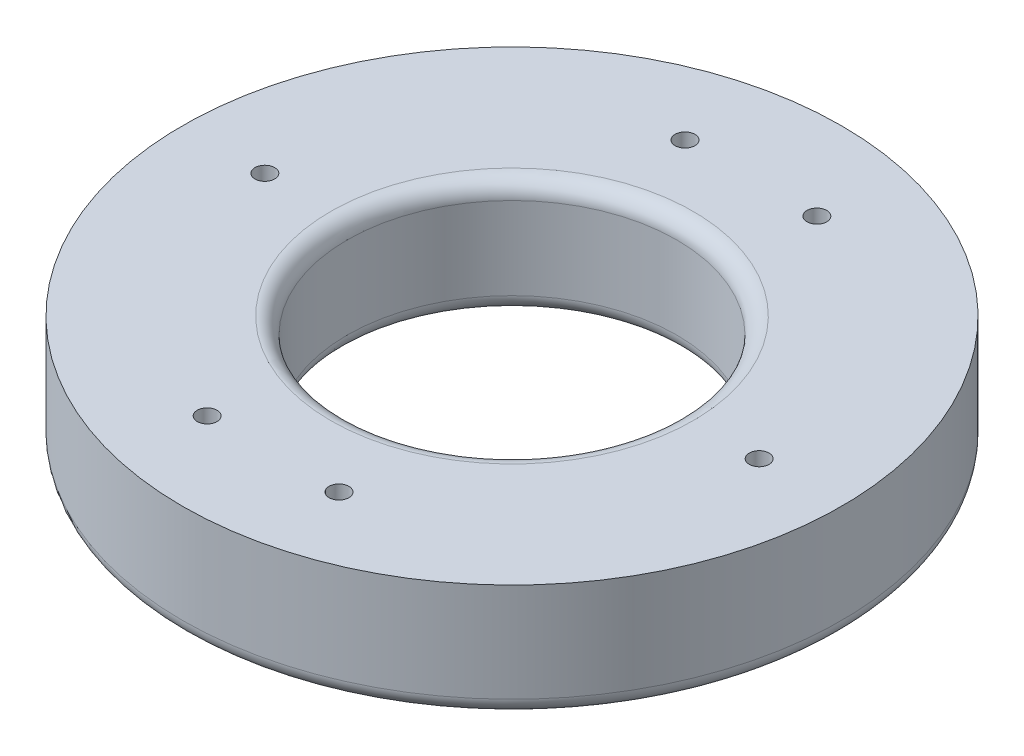
from build123d import *

# Parameters (mm, degrees)
SKETCH1_R           = 20
SKETCH1_R_2         = 0.6
SKETCH1_R_3         = 10
BOSS_EXTRUDE1_DEPTH = 7
FILLET1_R           = 1


with BuildPart() as part:
    # Sketch1 → Boss-Extrude1 (new body)
    with BuildSketch(Plane(origin=(0, 0, 0), x_dir=(1, 0, 0), z_dir=(0, 1, 0))):
        Circle(SKETCH1_R)
        with Locations((-4, 14.5)):
            Circle(SKETCH1_R_2, mode=Mode.SUBTRACT)
        with Locations((-4, -14.5)):
            Circle(SKETCH1_R_2, mode=Mode.SUBTRACT)
        with Locations((15, 0)):
            Circle(SKETCH1_R_2, mode=Mode.SUBTRACT)
        with Locations((-15, 0)):
            Circle(SKETCH1_R_2, mode=Mode.SUBTRACT)
        with Locations((4, 14.5)):
            Circle(SKETCH1_R_2, mode=Mode.SUBTRACT)
        with Locations((4, -14.5)):
            Circle(SKETCH1_R_2, mode=Mode.SUBTRACT)
        Circle(SKETCH1_R_3, mode=Mode.SUBTRACT)
    extrude(amount=BOSS_EXTRUDE1_DEPTH)

    # Fillet1
    fillet1_edges = [part.edges().sort_by_distance(p)[0] for p in [
        (-20, 0, 0),
        (-10, 0, 0),
        (-10, 7, 0),
    ]]
    fillet(fillet1_edges, radius=FILLET1_R)


solid = part.part
